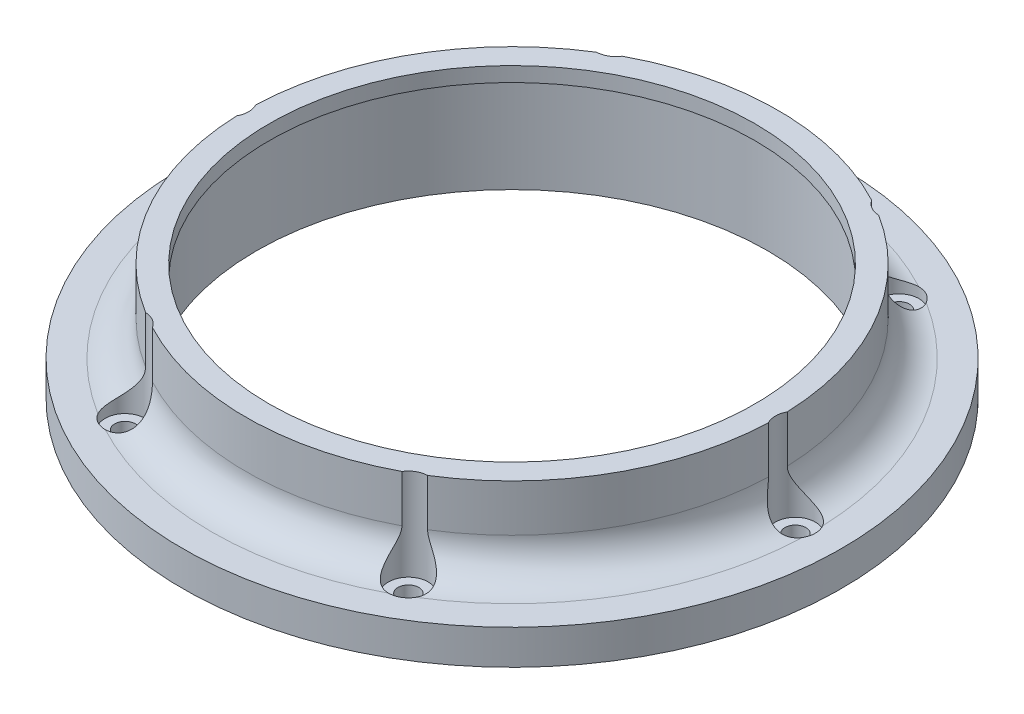
from build123d import *

# Parameters (mm, degrees)
SKETCH1_R           = 57.5
SKETCH1_R_2         = 55.25
BOSS_EXTRUDE1_DEPTH = 22
SKETCH2_R           = 71.25
SKETCH2_R_2         = 57.5
BOSS_EXTRUDE2_DEPTH = 7.5
FILLET2_R           = 7.5
SKETCH7_R           = 4.3
CUT_EXTRUDE1_DEPTH  = 102.800663063
CIRPATTERN1_COUNT   = 6
SKETCH8_R           = 52.5
BOSS_EXTRUDE3_DEPTH = 3.175


with BuildPart() as part:
    # Sketch1 → Boss-Extrude1 (new body)
    with BuildSketch(Plane(origin=(0, 0, 0), x_dir=(1, 0, 0), z_dir=(0, 1, 0))):
        with Locations(Location((0, 0, 0), (0, 0, 270))):
            Circle(SKETCH1_R)
        with Locations(Location((0, 0, 0), (0, 0, 270))):
            Circle(SKETCH1_R_2, mode=Mode.SUBTRACT)
    extrude(amount=BOSS_EXTRUDE1_DEPTH)

    # Sketch2 → Boss-Extrude2 (add)
    with BuildSketch(Plane.XZ):
        with Locations(Location((0, 0, 0), (0, 0, 270))):
            Circle(SKETCH2_R)
        with Locations(Location((0, 0, 0), (0, 0, 270))):
            Circle(SKETCH2_R_2, mode=Mode.SUBTRACT)
    extrude(amount=-BOSS_EXTRUDE2_DEPTH)

    # Sketch5 → CBORE for M4 SBHCS1 (revolve, cut)
    with BuildSketch(Plane(origin=(-61.25, 7.5, 0), x_dir=(0, 0, 1), z_dir=(1, 0, 0))):
        Polygon((0, 0), (0, 7.5), (2.25, 7.5), (2.25, 2.2), (4.3, 2.2), (4.3, 0), align=None)
    cbore_for_m4_sbhcs1 = revolve(axis=Axis((-61.25, 13.85, 0), (0, -1, 0)), mode=Mode.SUBTRACT)

    # Fillet2
    # the kernel refuses this fillet: 7.5 mm, written as the material it adds along each edge
    with BuildSketch(Plane(origin=(0, 7.5, 0), x_dir=(0, 0, 1), z_dir=(-1, 0, 0))) as fillet2_piece_1_section:
        with BuildLine():
            CenterArc((57.5 + FILLET2_R, FILLET2_R), FILLET2_R, 180, 90)
            Line((57.5 + FILLET2_R, 0), (57.5, 0))
            Line((57.5, 0), (57.5, FILLET2_R))
        make_face()
    fillet2_piece_1 = revolve(axis=Axis((0, 7.5, 0), (0, 1, 0)), revolution_arc=286.71849096, mode=Mode.PRIVATE)
    fillet2_piece_1 = fillet2_piece_1 - Plane(origin=(-61.25, 9.591155596, 0), x_dir=(0, 0, 1), z_dir=(0, 1, 0)) * Cylinder(4.3, 260, mode=Mode.PRIVATE)
    add(fillet2_piece_1)
    with BuildSketch(Plane(origin=(0, 7.5, 0), x_dir=(-0.9580279860671848, 0, -0.2866746900444024), z_dir=(0.2866746900444024, 0, -0.9580279860671848))) as fillet2_piece_2_section:
        with BuildLine():
            CenterArc((57.5 + FILLET2_R, FILLET2_R), FILLET2_R, 180, 90)
            Line((57.5 + FILLET2_R, 0), (57.5, 0))
            Line((57.5, 0), (57.5, FILLET2_R))
        make_face()
    fillet2_piece_2 = revolve(axis=Axis((0, 7.5, 0), (0, 1, 0)), revolution_arc=106.658978895, mode=Mode.PRIVATE)
    fillet2_piece_2 = fillet2_piece_2 - Plane(origin=(-61.25, 9.194240461, 0), x_dir=(0, 0, 1), z_dir=(0, 1, 0)) * Cylinder(4.3, 261, mode=Mode.PRIVATE)
    add(fillet2_piece_2)

    # Sketch7 → Cut-Extrude1 (cut, through all)
    with BuildSketch(Plane(origin=(0, 7.5, 0), x_dir=(1, 0, 0), z_dir=(0, 1, 0))):
        with Locations(Location((-61.25, 0, 0), (0, 0, 270))):
            Circle(SKETCH7_R)
    cut_extrude1 = extrude(amount=CUT_EXTRUDE1_DEPTH, mode=Mode.SUBTRACT)

    # CirPattern1: CBORE for M4 SBHCS1, Cut-Extrude1 ×6 about axis
    cirpattern1_axis = Axis((0, 0, 0), (0, 1, 0))
    add([cbore_for_m4_sbhcs1.rotate(cirpattern1_axis, i * 360 / CIRPATTERN1_COUNT) for i in range(1, CIRPATTERN1_COUNT)], mode=Mode.SUBTRACT)
    add([cut_extrude1.rotate(cirpattern1_axis, i * 360 / CIRPATTERN1_COUNT) for i in range(1, CIRPATTERN1_COUNT)], mode=Mode.SUBTRACT)

    # Sketch8 → Boss-Extrude3 (add)
    with BuildSketch(Plane(origin=(0, 22, 0), x_dir=(1, 0, 0), z_dir=(0, 1, 0))):
        with BuildLine():
            ThreePointArc((-57.463857143, -2.038411702), (-49.796460718, -28.75), (-30.497244888, -48.745954234))
            ThreePointArc((-30.497244888, -48.745954234), (-28.475, -49.320146746), (-26.966612254, -50.784365936))
            ThreePointArc((-26.966612254, -50.784365936), (0, -57.5), (26.966612254, -50.784365936))
            ThreePointArc((26.966612254, -50.784365936), (28.475, -49.320146746), (30.497244888, -48.745954234))
            ThreePointArc((30.497244888, -48.745954234), (49.796460718, -28.75), (57.463857143, -2.038411702))
            ThreePointArc((57.463857143, -2.038411702), (56.95, 0), (57.463857143, 2.038411702))
            ThreePointArc((57.463857143, 2.038411702), (49.796460718, 28.75), (30.497244888, 48.745954234))
            ThreePointArc((30.497244888, 48.745954234), (28.475, 49.320146746), (26.966612254, 50.784365936))
            ThreePointArc((26.966612254, 50.784365936), (0, 57.5), (-26.966612254, 50.784365936))
            ThreePointArc((-26.966612254, 50.784365936), (-28.475, 49.320146746), (-30.497244888, 48.745954234))
            ThreePointArc((-30.497244888, 48.745954234), (-49.796460718, 28.75), (-57.463857143, 2.038411702))
            ThreePointArc((-57.463857143, 2.038411702), (-56.95, 0), (-57.463857143, -2.038411702))
        make_face()
        with Locations(Location((0, 0, 0), (0, 0, 270))):
            Circle(SKETCH8_R, mode=Mode.SUBTRACT)
    extrude(amount=BOSS_EXTRUDE3_DEPTH)


solid = part.part
